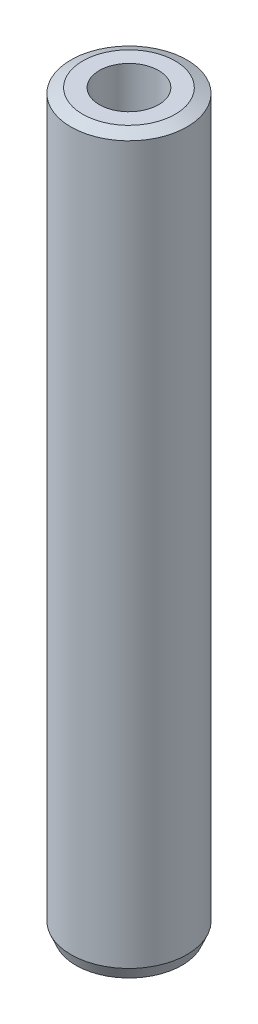
from build123d import *
from OCP.BRepFilletAPI import BRepFilletAPI_MakeChamfer

# Parameters (mm, degrees)
SKETCH1_R           = 47.5
BOSS_EXTRUDE1_DEPTH = 600
SKETCH2_R           = 24.245418365
CUT_EXTRUDE1_DEPTH  = 604.748706003
CHAMFER1_SIZE       = 4.132223245
CHAMFER1_SIZE2      = 9.687301331


with BuildPart() as part:
    # Sketch1 → Boss-Extrude1 (new body)
    with BuildSketch(Plane(origin=(0, 0, 0), x_dir=(1, 0, 0), z_dir=(0, 1, 0))):
        Circle(SKETCH1_R)
    extrude(amount=BOSS_EXTRUDE1_DEPTH)

    # Sketch2 → Cut-Extrude1 (cut, through all)
    with BuildSketch(Plane(origin=(0, 0, 0), x_dir=(1, 0, 0), z_dir=(0, 1, 0))):
        Circle(SKETCH2_R)
    extrude(amount=CUT_EXTRUDE1_DEPTH, mode=Mode.SUBTRACT)

    # Chamfer1: one chamfer whose edges measure the first distance from different faces: ONE call of the kernel's chamfer builder (chamfer() names one face for all edges)
    chamfer1_edges_1 = [part.edges().sort_by_distance(p)[0] for p in [
        (-47.5, 600, 0),
    ]]
    chamfer1_side_1 = [part.faces().sort_by_distance(p)[0] for p in [
        (-47.5, 300, 0),
    ]]
    chamfer1_edges_2 = [part.edges().sort_by_distance(p)[0] for p in [
        (-47.5, 0, 0),
    ]]
    chamfer1_side_2 = [part.faces().sort_by_distance(p)[0] for p in [
        (-46.156497116, 0, 0),
    ]]
    chamfer1 = BRepFilletAPI_MakeChamfer(part.part.solid().wrapped)
    for e in chamfer1_edges_1:
        chamfer1.Add(CHAMFER1_SIZE, CHAMFER1_SIZE2, e.wrapped, chamfer1_side_1[0].wrapped)  # the first distance lies on this face
    for e in chamfer1_edges_2:
        chamfer1.Add(CHAMFER1_SIZE, CHAMFER1_SIZE2, e.wrapped, chamfer1_side_2[0].wrapped)  # the first distance lies on this face
    add(Compound.cast(chamfer1.Shape()), mode=Mode.REPLACE)


solid = part.part
